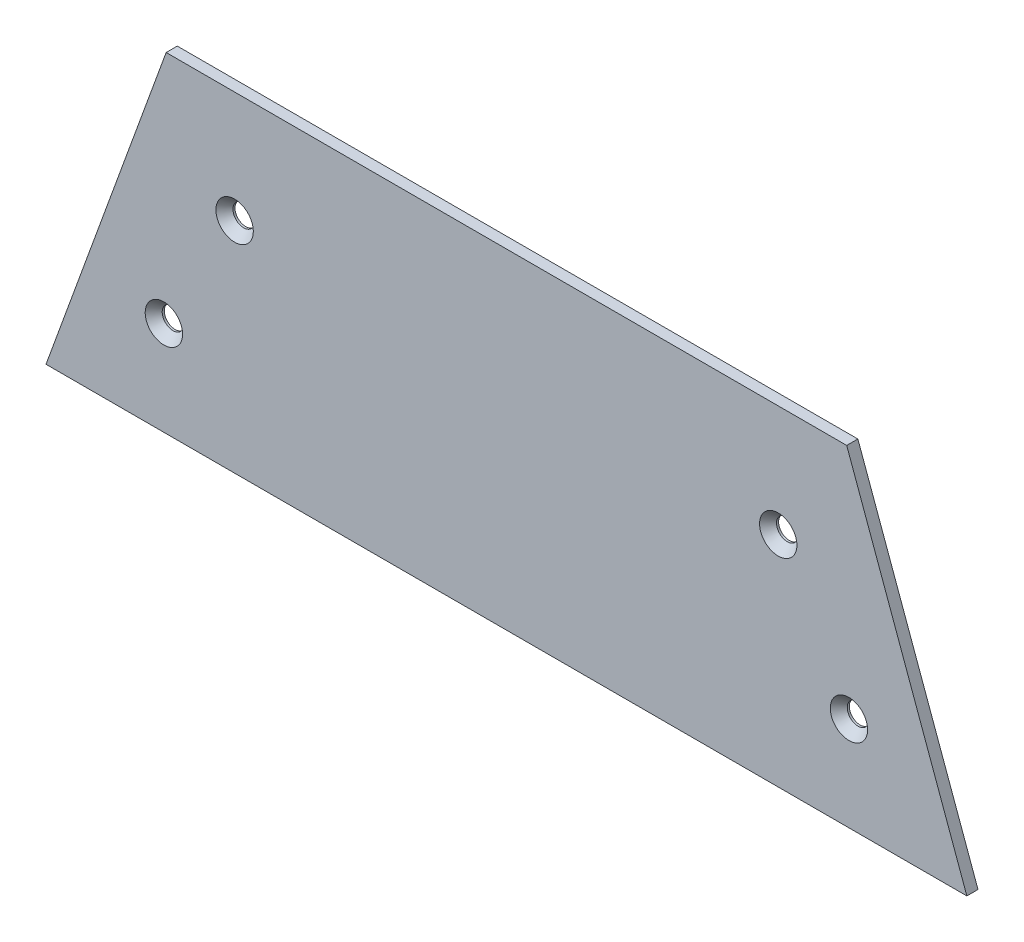
from build123d import *

# Parameters (mm, degrees)
SKETCH1_W                = 195.277
SKETCH1_H                = 70
MAIN_DEPTH               = 1.1811
ANGLECUTS_REACH          = 105.749
BRACKETHOLES_D           = 4.572
BRACKETHOLES_DEPTH       = 5
BRACKETHOLES_CSINK_D     = 7.9248
BRACKETHOLES_CSINK_ANGLE = 82


with BuildPart() as part:
    # Sketch1 → Main (new, symmetric)
    with BuildSketch(Plane.XY):
        Rectangle(SKETCH1_W, SKETCH1_H)
    extrude(amount=MAIN_DEPTH, both=True)

    # Sketch2 → AngleCuts (cut, up to next)
    with BuildSketch(Plane.XY.offset(1.1811), mode=Mode.PRIVATE) as anglecuts_sk1:
        Polygon((-97.6385, 35), (-72.160583601, 35), (-97.6385, -35), align=None)
    anglecuts_tool1 = extrude(anglecuts_sk1.sketch, amount=-ANGLECUTS_REACH, mode=Mode.PRIVATE) & part.part
    # Sketch2 → AngleCuts (cut, up to next)
    with BuildSketch(Plane.XY.offset(1.1811), mode=Mode.PRIVATE) as anglecuts_sk2:
        Polygon((97.6385, 35), (97.6385, -35), (72.160583601, 35), align=None)
    anglecuts_tool2 = extrude(anglecuts_sk2.sketch, amount=-ANGLECUTS_REACH, mode=Mode.PRIVATE) & part.part
    add(anglecuts_tool1.solids().sort_by_distance((-89.145861, 11.666667, 1.1811))[0], mode=Mode.SUBTRACT)
    add(anglecuts_tool2.solids().sort_by_distance((89.145861, 11.666667, 1.1811))[0], mode=Mode.SUBTRACT)

    # BracketHoles
    with Locations(Plane.XY.offset(1.1811)):
        with Locations((-72.6378, -15), (-57.6378, 11.3815573), (57.6378, 11.3815573), (72.6378, -15)):
            CounterSinkHole(BRACKETHOLES_D / 2, BRACKETHOLES_CSINK_D / 2, depth=BRACKETHOLES_DEPTH, counter_sink_angle=BRACKETHOLES_CSINK_ANGLE)


solid = part.part
